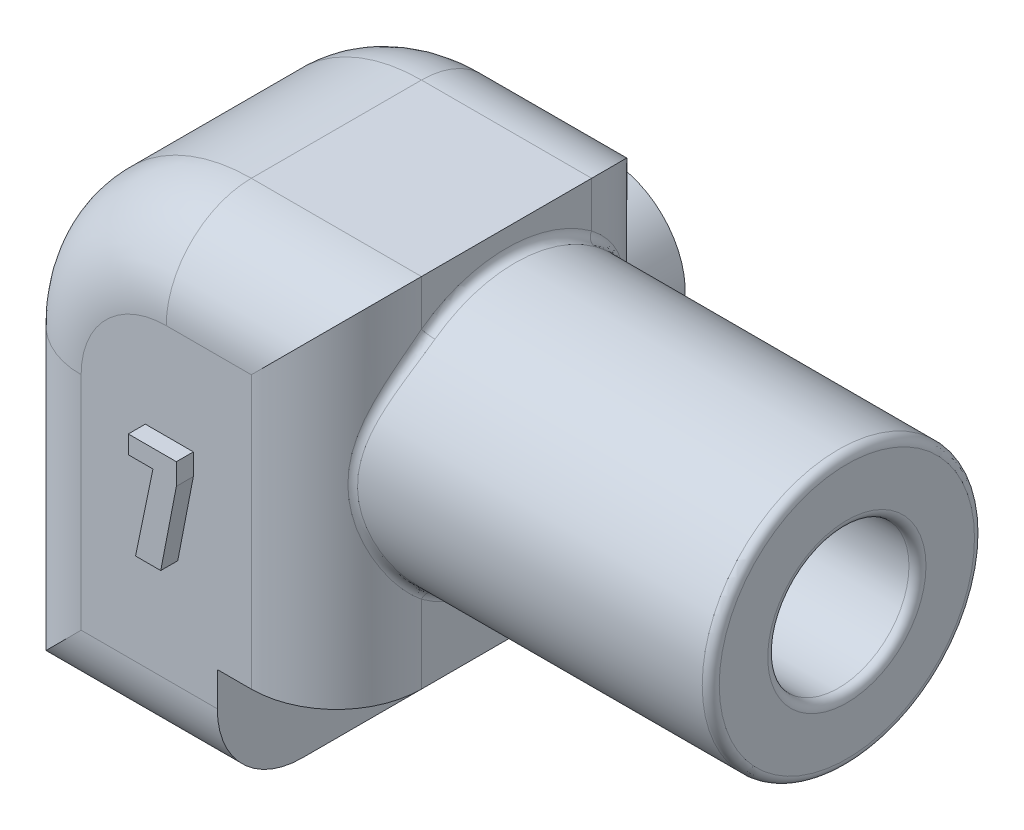
from build123d import *
from build123d.topology import SkipClean

# Parameters (mm, degrees)
BOSS_EXTRU_1_DEPTH       = 10
BOSS_EXTRU_1_DEPTH_BACK  = 10
ESQUISSE2_R              = 4
ENL_V_MAT_EXTRU_1_DEPTH  = 7
ESQUISSE3_W              = 20
ESQUISSE3_H              = 20
BOSS_EXTRU_2_DEPTH       = 8
EMPREINTE1_START         = -10
EMPREINTE1_OUTLINE_R     = 4
EMPREINTE1_DEPTH         = 14.813354444
CONG_1_R                 = 10
CONG_2_R                 = 5
ESQUISSE4_R              = 4.5
BOSS_EXTRU_3_DEPTH       = 6
ESQUISSE5_R              = 1.75
ENL_V_MAT_EXTRU_2_DEPTH  = 5
CONG_3_R                 = 0.25
ESQUISSE6_R              = 4.15
ENL_V_MAT_EXTRU_3_DEPTH  = 14.813354444
ESQUISSE7_R              = 4.15
ENL_V_MAT_EXTRU_5_DEPTH  = 7
BOSS_EXTRU_4_OUTLINE_R   = 8
BOSS_EXTRU_4_OUTLINE_R_2 = 4.15
BOSS_EXTRU_4_DEPTH       = 20
BOSS_EXTRU_4_START       = -5
BOSS_EXTRU_4_2_DEPTH     = 5
CONG_4_R                 = 0.5
CONG_5_R                 = 0.5
ESQUISSE9_R              = 8
ESQUISSE9_R_2            = 4.15
BOSS_EXTRU_6_DEPTH       = 22
CONG_6_R                 = 0.5
CONG_7_R                 = 0.25
CONG_8_R                 = 0.5
BOSS_EXTRU_7_DEPTH       = 1


with BuildPart() as part:
    # Esquisse1 → Boss.-Extru.1 (new, two sides: drawn at the far end of the back side and taken through both)
    with BuildSketch(Plane.XY.offset(-BOSS_EXTRU_1_DEPTH_BACK)):
        Polygon((-3, -10), (10, -10), (10, 10), (-10, 10), (-10, -3), (-3, -3), align=None)
    extrude(amount=BOSS_EXTRU_1_DEPTH + BOSS_EXTRU_1_DEPTH_BACK)

    # Esquisse2 → Enlèv. mat.-Extru.1 (cut)
    with BuildSketch(Plane(origin=(0, -10, 0), x_dir=(-1, 0, 0), z_dir=(0, -1, 0))):
        with Locations(Location((-3.5, 0, 0), (0, 0, 90))):
            Circle(ESQUISSE2_R)
    extrude(amount=-ENL_V_MAT_EXTRU_1_DEPTH, mode=Mode.SUBTRACT)

    # Esquisse3 → Boss.-Extru.2 (add)
    with BuildSketch(Plane(origin=(0, 10, 0), x_dir=(1, 0, 0), z_dir=(0, 1, 0))):
        Rectangle(ESQUISSE3_W, ESQUISSE3_H)
    extrude(amount=BOSS_EXTRU_2_DEPTH)

    # Empreinte1: read off the stored shape, not the designer's step
    # Empreinte1 outline → Empreinte1 (cut)
    with BuildSketch(Plane.YZ.offset(EMPREINTE1_START)):
        with Locations((8.447491166, 0)):
            Circle(EMPREINTE1_OUTLINE_R)
    extrude(amount=EMPREINTE1_DEPTH, mode=Mode.SUBTRACT)

    # Congé1
    cong_1_edges = [part.edges().sort_by_distance(p)[0] for p in [
        (10, 18, 0),
    ]]
    fillet(cong_1_edges, radius=CONG_1_R)

    # Congé2
    cong_2_edges = [part.edges().sort_by_distance(p)[0] for p in [
        (-10, 7.5, -10),
        (10, -1, 10),
        (-10, 7.5, 10),
        (3.5, -10, 10),
        (3.5, -10, -10),
        (-5, 18, 10),
        (10, -1, -10),
        (-5, 18, -10),
        (7.071067812, 15.071067812, -10),
        (7.071067812, 15.071067812, 10),
    ]]
    fillet(cong_2_edges, radius=CONG_2_R)


with BuildPart() as body_2:
    # Symétrie1: mirrored copy
    add(part.part.mirror(Plane(origin=(-3, -10, -10), x_dir=(0, 0, 1), z_dir=(0, -1, 0))))


with BuildPart() as body_2_2:
    # Symétrie3: mirrored copy
    add(body_2.part.mirror(Plane(origin=(-10, -27.201842148, 0), x_dir=(0, 0, 1), z_dir=(-1, 0, 0))))


with BuildPart() as body_2_3:
    # Symétrie4: mirrored copy
    add(body_2_2.part.mirror(Plane(origin=(-17, -10, -10), x_dir=(0, 0, 1), z_dir=(0, 1, 0))))

    # Esquisse4 → Boss.-Extru.3 (add)
    with BuildSketch(Plane(origin=(0, 0, -10), x_dir=(-1, 0, 0), z_dir=(0, 0, -1))):
        with Locations((20, 4)):
            Circle(ESQUISSE4_R)
    extrude(amount=BOSS_EXTRU_3_DEPTH)

    # Esquisse5 → Enlèv. mat.-Extru.2 (cut)
    with BuildSketch(Plane(origin=(0, 0, -16), x_dir=(-1, 0, 0), z_dir=(0, 0, -1))):
        with Locations((20, 4)):
            Circle(ESQUISSE5_R)
    extrude(amount=-ENL_V_MAT_EXTRU_2_DEPTH, mode=Mode.SUBTRACT)

    # Congé3
    cong_3_edges = [body_2_3.edges().sort_by_distance(p)[0] for p in [
        (-23.5, -10, 4),
        (-10, 4.447491166, 0),
    ]]
    fillet(cong_3_edges, radius=CONG_3_R)

    # Esquisse6 → Enlèv. mat.-Extru.3 (cut)
    with BuildSketch(Plane(origin=(-10, 0, 0), x_dir=(0, 0, -1), z_dir=(1, 0, 0))):
        with Locations((0, 8.447491166)):
            Circle(ESQUISSE6_R)
    extrude(amount=-ENL_V_MAT_EXTRU_3_DEPTH, mode=Mode.SUBTRACT)

    # Esquisse7 → Enlèv. mat.-Extru.5 (cut)
    with BuildSketch(Plane.XZ.offset(10)):
        with Locations(Location((-23.5, 0, 0), (0, 0, 270))):
            Circle(ESQUISSE7_R)
    extrude(amount=-ENL_V_MAT_EXTRU_5_DEPTH, mode=Mode.SUBTRACT)

    # Boss.-Extru.4: read off the stored shape, not the designer's step
    # Boss.-Extru.4 outline → Boss.-Extru.4 (add)
    with BuildSketch(Plane(origin=(-10, 0, 0), x_dir=(0, 0, -1), z_dir=(1, 0, 0))):
        with Locations((0, 8.447491166)):
            Circle(BOSS_EXTRU_4_OUTLINE_R)
        with Locations((0, 8.447491166)):
            Circle(BOSS_EXTRU_4_OUTLINE_R_2, mode=Mode.SUBTRACT)
    extrude(amount=BOSS_EXTRU_4_DEPTH)

    # Boss.-Extru.4 2 outline → Boss.-Extru.4 2 (add)
    with BuildSketch(Plane(origin=(-10, 0, 0), x_dir=(0, 0, -1), z_dir=(1, 0, 0)).offset(BOSS_EXTRU_4_START)):
        with BuildLine():
            Line((-5, 2.202493167), (-5, 14.692489164))
            ThreePointArc((-5, 14.692489164), (-8, 8.447491166), (-5, 2.202493167))
        make_face()
    extrude(amount=BOSS_EXTRU_4_2_DEPTH)

    # Congé4
    cong_4_edges = [body_2_3.edges().sort_by_distance(p)[0] for p in [
        (10, 8.447491166, 8),
    ]]
    fillet(cong_4_edges, radius=CONG_4_R)

    # Congé5
    cong_5_edges = [body_2_3.edges().sort_by_distance(p)[0] for p in [
        (10, 8.447491166, 4.15),
    ]]
    fillet(cong_5_edges, radius=CONG_5_R)


with BuildPart() as boss_extru_6_tool:
    # Esquisse9 → Boss.-Extru.6 (new body)
    with SkipClean():  # the faces are left unmerged after this step: merging them gives an invalid solid
        with BuildSketch(Plane(origin=(10, 0, 0), x_dir=(0, 0, -1), z_dir=(1, 0, 0))):
            with Locations(Location((0, 8.447491166, 0), (0, 0, 231.317812547))):
                Circle(ESQUISSE9_R)
            with Locations((0, 8.447491166)):
                Circle(ESQUISSE9_R_2, mode=Mode.SUBTRACT)
        extrude(amount=-BOSS_EXTRU_6_DEPTH)


with BuildPart() as body_2_3_1:
    with SkipClean():  # the faces are left unmerged after this step: merging them gives an invalid solid
        add(body_2_3.part)


with BuildPart() as body_2_3_2:
    # Boss.-Extru.6: joined with boss_extru_6_tool
    with SkipClean():  # the faces are left unmerged after this step: merging them gives an invalid solid
        add(body_2_3_1.part.fuse(boss_extru_6_tool.part, tol=0.00001))

    # Congé6
    # the kernel refuses this fillet: 0.5 mm, written as the material it takes off along each edge
    with BuildSketch(Plane(origin=(10, 8.447491166, 0), x_dir=(0, 0, -1), z_dir=(0, -1, 0))) as cong_6_piece_1:
        with BuildLine():
            CenterArc((4.15 + CONG_6_R, -CONG_6_R), CONG_6_R, 90, 90)
            Line((4.15, -CONG_6_R), (4.15, 0))
            Line((4.15, 0), (4.15 + CONG_6_R, 0))
        make_face()
    revolve(axis=Axis((10, 8.447491166, 0), (1, 0, 0)), mode=Mode.SUBTRACT)
    with BuildSketch(Plane(origin=(10, 8.447491166, 0), x_dir=(0, -0.7806247498051386, 0.6249999999933319), z_dir=(0, 0.6249999999933319, 0.7806247498051386))) as cong_6_piece_2:
        with BuildLine():
            CenterArc((8 - CONG_6_R, -CONG_6_R), CONG_6_R, 360, 90)
            Line((8, -CONG_6_R), (8, 0))
            Line((8, 0), (8 - CONG_6_R, 0))
        make_face()
    revolve(axis=Axis((10, 8.447491166, 0), (1, 0, 0)), mode=Mode.SUBTRACT)

    # Congé7
    cong_7_edges = [body_2_3_2.edges().sort_by_distance(p)[0] for p in [
        (-23.5, -9.979128785, 4.15),
    ]]
    fillet(cong_7_edges, radius=CONG_7_R - 0.0001)  # a hair under: the kernel refuses the full size

    # Congé8
    cong_8_edges = [body_2_3_2.edges().sort_by_distance(p)[0] for p in [
        (-10, 16.447491166, 0),
        (-11, 8.447491166, -8),
        (-11, 8.447491165, 8),
    ]]
    fillet(cong_8_edges, radius=CONG_8_R)

    # Esquisse10 → Boss.-Extru.7 (add)
    with BuildSketch(Plane.XY.offset(10)):
        Polygon((-18.404253987, 7.373694741), (-18.404253987, 6.120753565), (-19.321901046, 1.373694741), (-20.804253987, 1.373694741), (-19.780724575, 6.314871212), (-21.227783399, 6.314871212), (-21.227783399, 7.373694741), align=None)
    extrude(amount=BOSS_EXTRU_7_DEPTH)


solid = body_2_3_2.part
